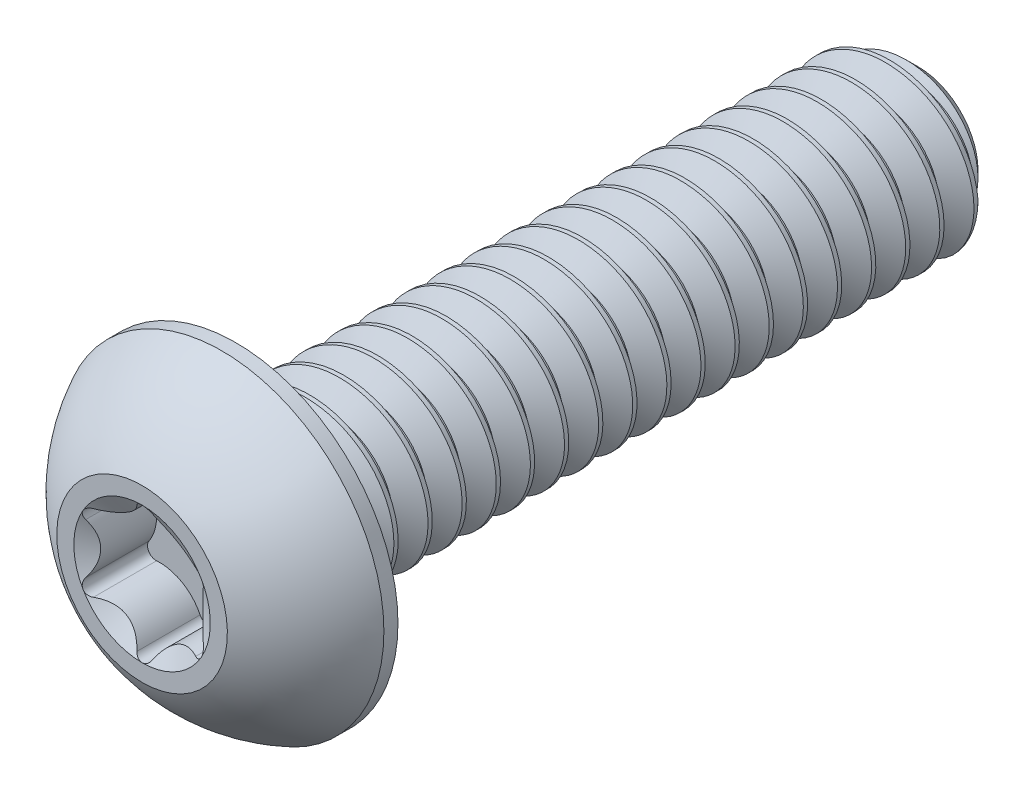
from build123d import *

# Parameters (mm, degrees)
SKETCH1_W          = 8
SKETCH1_H          = 1
CHAMFER1_SIZE      = 0.3
CUT_SWEEP1_PITCH   = 0.4
CUT_EXTRUDE2_DEPTH = 0.77
CIRPATTERN1_COUNT  = 6


with BuildPart() as part:
    # Sketch1 → Revolve1 (revolve)
    with BuildSketch(Plane(origin=(0, 0, 0), x_dir=(0, 0, -1), z_dir=(1, 0, 0))):
        with Locations((5.1, 0.5)):
            Rectangle(SKETCH1_W, SKETCH1_H)
    revolve(axis=Axis((0, 0, -9.1), (0, 0, 1)))

    # Chamfer1
    chamfer1_edges = [part.edges().sort_by_distance(p)[0] for p in [
        (0, -1, -9.1),
    ]]
    chamfer(chamfer1_edges, length=CHAMFER1_SIZE)

    # Cut-Sweep1: the profile of Sketch2 profile screwed along a right-hand helix of 21 turns, 6 arcs to a turn; built about Z, then put on its axis
    cut_sweep1_z = Axis((0, 0, 0), (0, 0, 1))
    cut_sweep1_corners = [(1.0003, 0, 0.000173205), (1.0003, 0, -0.350173205), (0.740192379, 0, -0.2), (0.740192379, 0, -0.15)]
    with BuildLine(mode=Mode.PRIVATE) as cut_sweep1_profile:
        Line(cut_sweep1_corners[0], cut_sweep1_corners[1])
        Line(cut_sweep1_corners[1], cut_sweep1_corners[2])
        Line(cut_sweep1_corners[2], cut_sweep1_corners[3])
        Line(cut_sweep1_corners[3], cut_sweep1_corners[0])
    cut_sweep1_cap = Face(cut_sweep1_profile.wire())
    cut_sweep1_turn_angles = [0, 30, 60, 90, 120, 150, 180, 210, 240, 270, 300, 330, 360]
    cut_sweep1_turn_weights = [1, 0.8660254037844387, 1, 0.8660254037844387, 1, 0.8660254037844387, 1, 0.8660254037844387, 1, 0.8660254037844387, 1, 0.8660254037844387, 1]
    cut_sweep1_turn_rails = [Edge.make_bspline([Vector(p[0], p[1], 0).rotate(cut_sweep1_z, cut_sweep1_turn_angles[k]) / cut_sweep1_turn_weights[k] + Vector(0, 0, p[2] + CUT_SWEEP1_PITCH * cut_sweep1_turn_angles[k] / 360) for k in range(13)], [0, 0, 0, 1, 1, 2, 2, 3, 3, 4, 4, 5, 5, 6, 6, 6], 2, cut_sweep1_turn_weights) for p in cut_sweep1_corners]
    cut_sweep1_turn_sides = [Face.make_surface_from_curves(cut_sweep1_turn_rails[p[0]], cut_sweep1_turn_rails[p[1]]) for p in [(0, 1), (1, 2), (2, 3), (3, 0)]]
    cut_sweep1 = Plane(origin=(0, 0, -9.1), x_dir=(0, 1, 0), z_dir=(0, 0, 1)) * Solid(Shell([*[p.moved(Location((0, 0, CUT_SWEEP1_PITCH * i))) for i in range(21) for p in cut_sweep1_turn_sides], cut_sweep1_cap, cut_sweep1_cap.rotate(cut_sweep1_z, 7560).moved(Location((0, 0, CUT_SWEEP1_PITCH * 7560 / 360)))]))
    add(cut_sweep1, mode=Mode.SUBTRACT)

    # Sketch7 → Revolve2 (revolve)
    with BuildSketch(Plane(origin=(0, 0, 0), x_dir=(0, 0, -1), z_dir=(1, 0, 0)), mode=Mode.PRIVATE) as revolve2_sk:
        with BuildLine():
            Line((0.935, 1.9), (1.1, 1.9))
            Line((1.1, 1.9), (1.1, 0))
            Line((1.1, 0), (0, 0))
            Line((0, 0), (0, 1))
            ThreePointArc((0, 1), (0.396750073, 1.523501313), (0.935, 1.9))
        make_face()
    revolve(revolve2_sk.sketch.rotate(Axis((0, 0, 0), (0, 0, -1)), 189.336081704), axis=Axis((0, 0, 0), (0, 0, -1)))

    # Sketch5 → Cut-Extrude2 (cut)
    with BuildSketch(Plane.XY):
        with BuildLine():
            Line((0, 0), (-0.692820323, 0.4))
            ThreePointArc((-0.692820323, 0.4), (-0.706163843, 0.346715947), (-0.68935124, 0.294422772))
            ThreePointArc((-0.68935124, 0.294422772), (-0.6, 0), (-0.68935124, -0.294422772))
            ThreePointArc((-0.68935124, -0.294422772), (-0.706163843, -0.346715947), (-0.692820323, -0.4))
            Line((-0.692820323, -0.4), (0, 0))
        make_face()
    cut_extrude2 = extrude(amount=-CUT_EXTRUDE2_DEPTH, mode=Mode.SUBTRACT)

    # CirPattern1: Cut-Extrude2 ×6 about axis
    cirpattern1_axis = Axis((0, 0, 0), (0, 0, -1))
    for i in range(1, CIRPATTERN1_COUNT):
        add(cut_extrude2.rotate(cirpattern1_axis, i * 360 / CIRPATTERN1_COUNT), mode=Mode.SUBTRACT)

    # Cut-Extrude3 cone 1 section (through the dimple's axis) → Cut-Extrude3 (revolve, cut)
    with BuildSketch(Plane(origin=(0, 0, 0), x_dir=(0, -1, 0), z_dir=(1, 0, 0))):
        Polygon((0, 0), (0.8, 0), (0, 0.461880215), align=None)
    revolve(axis=Axis((0, 0, 0), (0, 0, -1)), mode=Mode.SUBTRACT)


solid = part.part
